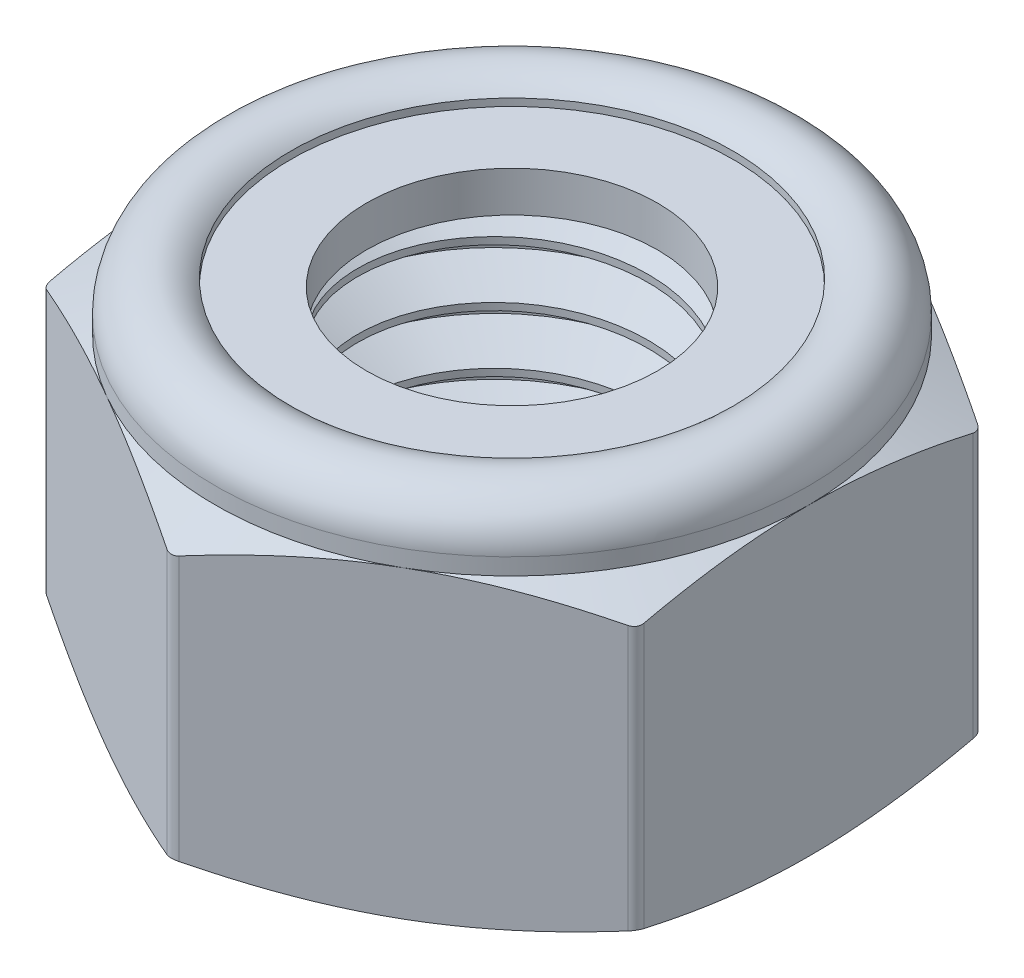
from build123d import *

# Parameters (mm, degrees)
BOSS_EXTRUDE1_DEPTH      = 4
BOSS_EXTRUDE1_DEPTH_BACK = 4
SKETCH2_R                = 3.188101184
FILLET1_R                = 0.26
SKETCH4_W                = 1.655949408
SKETCH4_H                = 0.889217332
SKETCH6_W                = 4
SKETCH6_H                = 6.666666667
CUT_SWEEP1_PITCH         = 1.25
SKETCH10_R               = 3.988101184
BOSS_EXTRUDE2_DEPTH      = 6.666666667


with BuildPart() as part:
    # Sketch2 → Boss-Extrude1 (new, two sides: drawn at the far end of the back side and taken through both)
    with BuildSketch(Plane(origin=(0, 0, 0), x_dir=(1, 0, 0), z_dir=(0, 1, 0)).offset(-BOSS_EXTRUDE1_DEPTH_BACK)):
        Polygon((0, 7.505553499), (-6.5, 3.75277675), (-6.5, -3.75277675), (0, -7.505553499), (6.5, -3.75277675), (6.5, 3.75277675), align=None)
        with Locations(Location((0, 0, 0), (0, 0, 270))):
            Circle(SKETCH2_R, mode=Mode.SUBTRACT)
    extrude(amount=BOSS_EXTRUDE1_DEPTH + BOSS_EXTRUDE1_DEPTH_BACK)

    # Fillet1
    fillet1_edges = [part.edges().sort_by_distance(p)[0] for p in [
        (6.5, 0, -3.75277675),
        (6.5, 0, 3.75277675),
        (0, 0, 7.505553499),
        (-6.5, 0, 3.75277675),
        (-6.5, 0, -3.75277675),
        (0, 0, -7.505553499),
    ]]
    fillet(fillet1_edges, radius=FILLET1_R)

    # Sketch3 → Cut-Revolve2 (revolve, cut)
    with BuildSketch(Plane(origin=(0, 0, 0), x_dir=(0, 0, -1), z_dir=(1, 0, 0)), mode=Mode.PRIVATE) as cut_revolve2_sk:
        with BuildLine():
            Line((7.505553499, 2.666666667), (7.505553499, 5))
            Line((7.505553499, 5), (3.188101184, 5))
            Line((3.188101184, 5), (3.188101184, 2.666666667))
            Line((3.188101184, 2.666666667), (4.844050592, 2.666666667))
            Line((4.844050592, 2.666666667), (4.844050592, 3.715883999))
            ThreePointArc((4.844050592, 3.715883999), (5.90118274, 3.926160657), (6.5, 3.029967295))
            Line((6.5, 3.029967295), (6.5, 2.666666667))
            Line((6.5, 2.666666667), (7.505553499, 2.197769369))
            Line((7.505553499, 2.197769369), (7.505553499, 2.666666667))
        make_face()
        Polygon((6.5, -4), (7.505553499, -3.531102703), (7.505553499, -4), align=None)
        Polygon((3.188101184, -4), (3.188101184, -3.2), (3.988101184, -4), align=None)
    revolve(cut_revolve2_sk.sketch.rotate(Axis((0, -4, 0), (0, 1, 0)), 270), axis=Axis((0, -4, 0), (0, 1, 0)), mode=Mode.SUBTRACT)

    # Sketch10 → Boss-Extrude2 (add)
    with BuildSketch(Plane.XZ.offset(4)):
        Circle(SKETCH10_R)
    extrude(amount=-BOSS_EXTRUDE2_DEPTH)


with BuildPart() as body_2:
    # Sketch4 → Revolve1 (revolve)
    with BuildSketch(Plane(origin=(0, 0, 0), x_dir=(0, 0, -1), z_dir=(1, 0, 0)), mode=Mode.PRIVATE) as revolve1_sk:
        with Locations((-4.016075888, 3.111275333)):
            Rectangle(SKETCH4_W, SKETCH4_H)
    revolve(revolve1_sk.sketch.rotate(Axis((0, -4, 0), (0, 1, 0)), 90), axis=Axis((0, -4, 0), (0, 1, 0)))


with BuildPart() as body_3:
    # Sketch6 → Revolve2 (revolve)
    with BuildSketch(Plane.XY, mode=Mode.PRIVATE) as revolve2_sk:
        with Locations((2, -0.666666666)):
            Rectangle(SKETCH6_W, SKETCH6_H)
    revolve(revolve2_sk.sketch.rotate(Axis((0, -4, 0), (0, 1, 0)), 90), axis=Axis((0, -4, 0), (0, 1, 0)))

    # Cut-Sweep1: the profile of Sketch8 profile screwed along a right-hand helix of 6.4 turns, 8 arcs to a turn; built about Z, then put on its axis
    cut_sweep1_z = Axis((0, 0, 0), (0, 0, 1))
    cut_sweep1_corners = [(3.187801184, 0, -0.468923205), (3.187801184, 0, -0.624826795), (4.067658235, 0, -1.1328125), (4.135316469, 0, 0.078125)]
    with BuildLine(mode=Mode.PRIVATE) as cut_sweep1_profile:
        Line(cut_sweep1_corners[0], cut_sweep1_corners[1])
        Line(cut_sweep1_corners[1], cut_sweep1_corners[2])
        Line(cut_sweep1_corners[2], cut_sweep1_corners[3])
        Line(cut_sweep1_corners[3], cut_sweep1_corners[0])
    cut_sweep1_cap = Face(cut_sweep1_profile.wire())
    cut_sweep1_turn_angles = [0, 22.5, 45, 67.5, 90, 112.5, 135, 157.5, 180, 202.5, 225, 247.5, 270, 292.5, 315, 337.5, 360]
    cut_sweep1_turn_weights = [1, 0.9238795325112867, 1, 0.9238795325112867, 1, 0.9238795325112867, 1, 0.9238795325112867, 1, 0.9238795325112867, 1, 0.9238795325112867, 1, 0.9238795325112867, 1, 0.9238795325112867, 1]
    cut_sweep1_turn_rails = [Edge.make_bspline([Vector(p[0], p[1], 0).rotate(cut_sweep1_z, cut_sweep1_turn_angles[k]) / cut_sweep1_turn_weights[k] + Vector(0, 0, p[2] + CUT_SWEEP1_PITCH * cut_sweep1_turn_angles[k] / 360) for k in range(17)], [0, 0, 0, 1, 1, 2, 2, 3, 3, 4, 4, 5, 5, 6, 6, 7, 7, 8, 8, 8], 2, cut_sweep1_turn_weights) for p in cut_sweep1_corners]
    cut_sweep1_turn_sides = [Face.make_surface_from_curves(cut_sweep1_turn_rails[p[0]], cut_sweep1_turn_rails[p[1]]) for p in [(0, 1), (1, 2), (2, 3), (3, 0)]]
    cut_sweep1_last_angles = [2160, 2182.5, 2205, 2227.5, 2250, 2272.5, 2295, 2299.5, 2304]
    cut_sweep1_last_weights = [1, 0.9238795325112867, 1, 0.9238795325112867, 1, 0.9238795325112867, 1, 0.9969173337331274, 1]
    cut_sweep1_last_rails = [Edge.make_bspline([Vector(p[0], p[1], 0).rotate(cut_sweep1_z, cut_sweep1_last_angles[k]) / cut_sweep1_last_weights[k] + Vector(0, 0, p[2] + CUT_SWEEP1_PITCH * cut_sweep1_last_angles[k] / 360) for k in range(9)], [0, 0, 0, 1, 1, 2, 2, 3, 3, 4, 4, 4], 2, cut_sweep1_last_weights) for p in cut_sweep1_corners]
    cut_sweep1_last_sides = [Face.make_surface_from_curves(cut_sweep1_last_rails[p[0]], cut_sweep1_last_rails[p[1]]) for p in [(0, 1), (1, 2), (2, 3), (3, 0)]]
    cut_sweep1 = Plane(origin=(0, -4, 0), x_dir=(1, 0, 0), z_dir=(0, 1, 0)) * Solid(Shell([*[p.moved(Location((0, 0, CUT_SWEEP1_PITCH * i))) for i in range(6) for p in cut_sweep1_turn_sides], *cut_sweep1_last_sides, cut_sweep1_cap, cut_sweep1_cap.rotate(cut_sweep1_z, 2304).moved(Location((0, 0, CUT_SWEEP1_PITCH * 2304 / 360)))]))
    add(cut_sweep1, mode=Mode.SUBTRACT)

    # Sketch9 → Revolve3 (revolve)
    with BuildSketch(Plane.XY, mode=Mode.PRIVATE) as revolve3_sk:
        Polygon((0, 0), (0, -4), (4, -4), (4.8, -4), (0, 0.8), align=None)
    revolve(revolve3_sk.sketch.rotate(Axis((0, 0, 0), (0, -1, 0)), 75.588981792), axis=Axis((0, 0, 0), (0, -1, 0)))


with BuildPart() as part_1:
    add(part.part)

    # Combine1: cut body 3
    add(body_3.part, mode=Mode.SUBTRACT)


solid = Compound([body_2.part, part_1.part])
